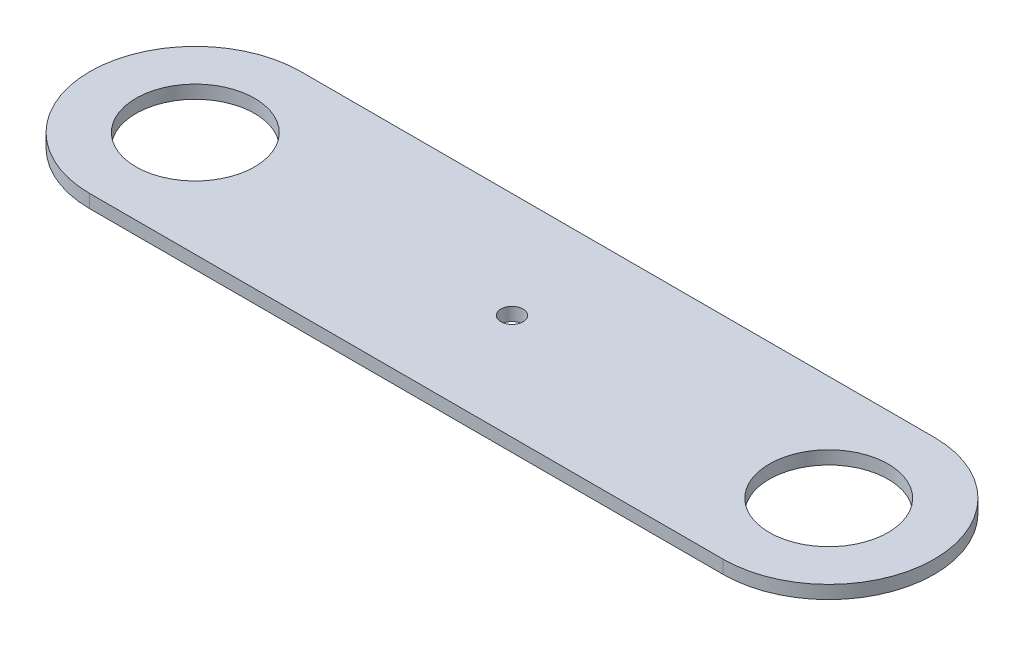
from build123d import *

# Parameters (mm, degrees)
SKETCH1_R           = 14.2875
BOSS_EXTRUDE1_DEPTH = 3.175
CUT_EXTRUDE1_REACH  = 181.633
SKETCH2_R           = 2.667


with BuildPart() as part:
    # Sketch1 → Boss-Extrude1 (new body)
    with BuildSketch(Plane(origin=(0, 0, 0), x_dir=(1, 0, 0), z_dir=(0, 1, 0))):
        with BuildLine():
            Line((0, 25.4), (152.4, 25.4))
            ThreePointArc((152.4, 25.4), (177.8, 0), (152.4, -25.4))
            Line((152.4, -25.4), (0, -25.4))
            ThreePointArc((0, -25.4), (-25.4, 0), (0, 25.4))
        make_face()
        Circle(SKETCH1_R, mode=Mode.SUBTRACT)
        with Locations((152.4, 0)):
            Circle(SKETCH1_R, mode=Mode.SUBTRACT)
    extrude(amount=BOSS_EXTRUDE1_DEPTH)

    # Sketch2 → Cut-Extrude1 (cut, up to next)
    with BuildSketch(Plane(origin=(0, 3.175, 0), x_dir=(1, 0, 0), z_dir=(0, 1, 0)), mode=Mode.PRIVATE) as cut_extrude1_sk1:
        with Locations((76.2, 0)):
            Circle(SKETCH2_R)
    cut_extrude1_tool1 = extrude(cut_extrude1_sk1.sketch, amount=-CUT_EXTRUDE1_REACH, mode=Mode.PRIVATE) & part.part
    add(cut_extrude1_tool1.solids().sort_by_distance((76.2, 3.175, 0))[0], mode=Mode.SUBTRACT)


solid = part.part
